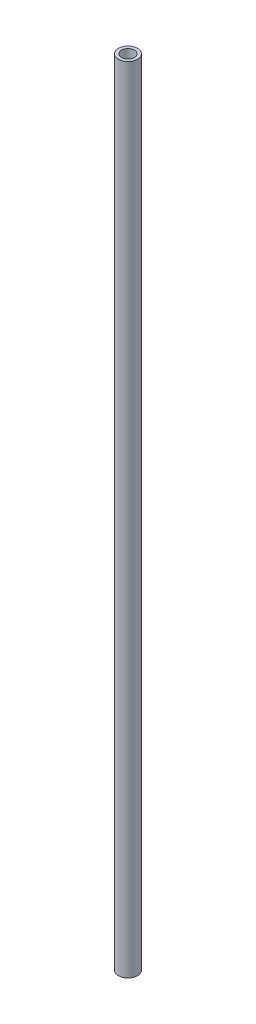
from build123d import *

# Parameters (mm, degrees)
SKETCH1_R           = 4.8895
SKETCH1_R_2         = 3.302
BOSS_EXTRUDE1_DEPTH = 406.4


with BuildPart() as part:
    # Sketch1 → Boss-Extrude1 (new body)
    with BuildSketch(Plane(origin=(0, 0, 0), x_dir=(1, 0, 0), z_dir=(0, 1, 0))):
        Circle(SKETCH1_R)
        Circle(SKETCH1_R_2, mode=Mode.SUBTRACT)
    extrude(amount=BOSS_EXTRUDE1_DEPTH)


solid = part.part
